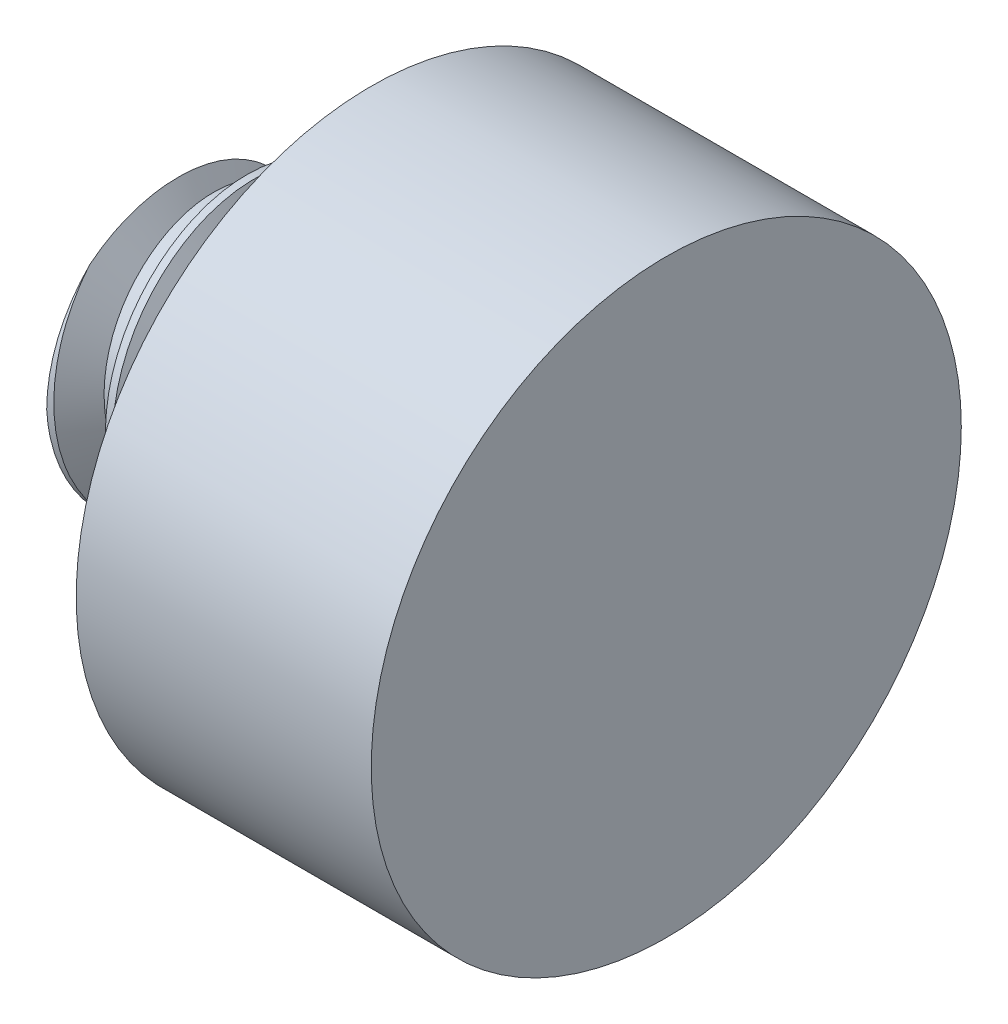
from build123d import *

# Parameters (mm, degrees)
THREAD1_PITCH = 1.27


with BuildPart() as part:
    # Sketch1 → Revolve1 (revolve)
    with BuildSketch(Plane.XY, mode=Mode.PRIVATE) as revolve1_sk:
        Polygon((0, 0), (0, 3.175), (3.81, 3.175), (3.81, 6.35), (10.16, 6.35), (10.16, 0), align=None)
    revolve(revolve1_sk.sketch.rotate(Axis((10.16, 0, 0), (-1, 0, 0)), 90), axis=Axis((10.16, 0, 0), (-1, 0, 0)))

    # Thread1: the profile of Thread Profile1 profile screwed along a right-hand helix of 3 turns, 8 arcs to a turn; built about Z, then put on its axis
    thread1_z = Axis((0, 0, 0), (0, 0, 1))
    thread1_corners = [(3.1753, 0, -0.000173205), (3.1753, 0, 1.111423202), (2.487592339, 0, 0.714374998), (2.487592339, 0, 0.396874998)]
    with BuildLine(mode=Mode.PRIVATE) as thread1_profile:
        Line(thread1_corners[0], thread1_corners[1])
        Line(thread1_corners[1], thread1_corners[2])
        Line(thread1_corners[2], thread1_corners[3])
        Line(thread1_corners[3], thread1_corners[0])
    thread1_cap = Face(thread1_profile.wire())
    thread1_turn_angles = [0, 22.5, 45, 67.5, 90, 112.5, 135, 157.5, 180, 202.5, 225, 247.5, 270, 292.5, 315, 337.5, 360]
    thread1_turn_weights = [1, 0.9238795325112867, 1, 0.9238795325112867, 1, 0.9238795325112867, 1, 0.9238795325112867, 1, 0.9238795325112867, 1, 0.9238795325112867, 1, 0.9238795325112867, 1, 0.9238795325112867, 1]
    thread1_turn_rails = [Edge.make_bspline([Vector(p[0], p[1], 0).rotate(thread1_z, thread1_turn_angles[k]) / thread1_turn_weights[k] + Vector(0, 0, p[2] + THREAD1_PITCH * thread1_turn_angles[k] / 360) for k in range(17)], [0, 0, 0, 1, 1, 2, 2, 3, 3, 4, 4, 5, 5, 6, 6, 7, 7, 8, 8, 8], 2, thread1_turn_weights) for p in thread1_corners]
    thread1_turn_sides = [Face.make_surface_from_curves(thread1_turn_rails[p[0]], thread1_turn_rails[p[1]]) for p in [(0, 1), (1, 2), (2, 3), (3, 0)]]
    thread1 = Plane(origin=(3.81, 0, 0), x_dir=(0, 0, 1), z_dir=(-1, 0, 0)) * Solid(Shell([*[p.moved(Location((0, 0, THREAD1_PITCH * i))) for i in range(3) for p in thread1_turn_sides], thread1_cap, thread1_cap.rotate(thread1_z, 1080).moved(Location((0, 0, THREAD1_PITCH * 1080 / 360)))]))
    add(thread1, mode=Mode.SUBTRACT)


solid = part.part
